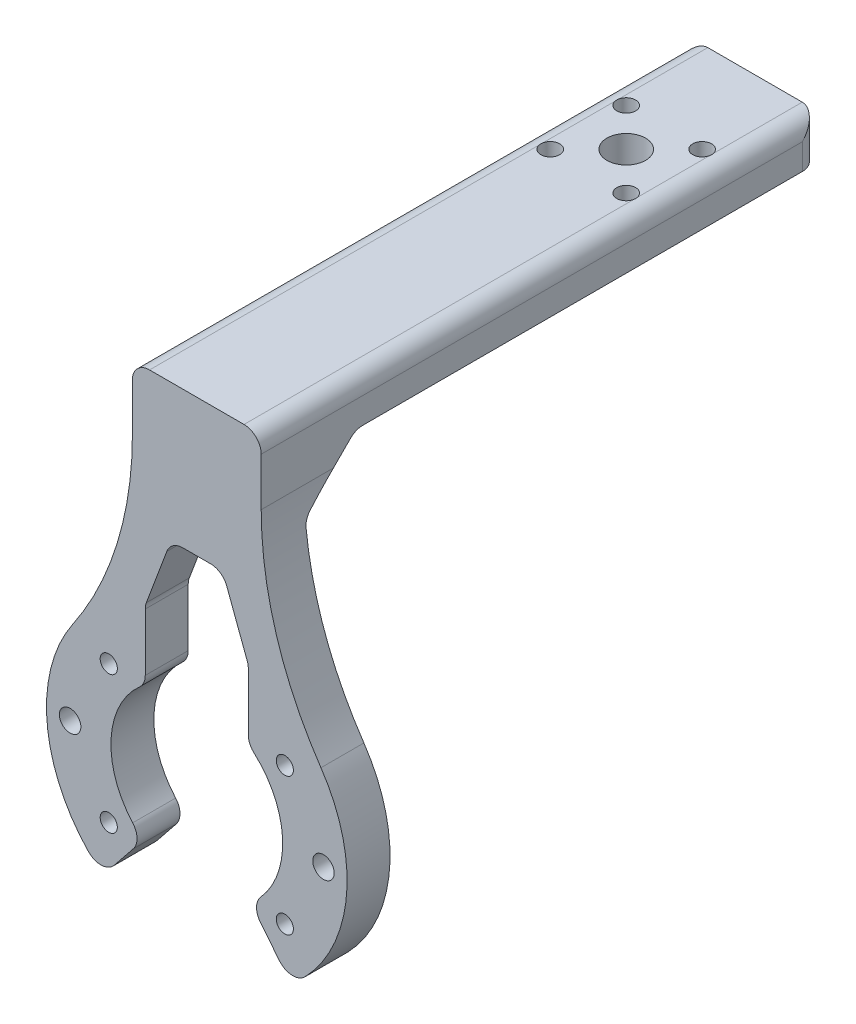
from build123d import *

# Parameters (mm, degrees)
SKETCH_1_R                   = 1
SKETCH_1_R_2                 = 1.25
EXTRUDE_1_DEPTH              = 5
EXTRUDE_2_DEPTH              = 7.5
SKETCH_5_R                   = 2.25
CUT_EXTRUDE_1_DEPTH          = 15
FILLET_2_R                   = 40
HOLE_WIZARD_M2_1_D           = 2.2
HOLE_WIZARD_M2_1_CBORE_D     = 4.3
HOLE_WIZARD_M2_1_CBORE_DEPTH = 2.3
CUT_EXTRUDE_2_DEPTH          = 79.302298817
FILLET_1_R                   = 2


with BuildPart() as part:
    # 草图1 → 凸台-拉伸1 (new body)
    # profile 1 of 2: a face of its own
    with BuildSketch(Plane.XY):
        with BuildLine():
            ThreePointArc((7.5, 15.811388301), (0, 17.5), (-7.5, 15.811388301))
            ThreePointArc((-7.5, 15.811388301), (-17.382056071, 2.028331029), (-10.939015625, -13.659719512))
            Line((-10.939015625, -13.659719512), (-6.250866071, -7.805554007))
            ThreePointArc((-6.250866071, -7.805554007), (-4.329626963, 9.01411839), (10, 0))
            ThreePointArc((10, 0), (9.01411839, -4.329626963), (6.250866071, -7.805554007))
            Line((6.250866071, -7.805554007), (10.939015625, -13.659719512))
            ThreePointArc((10.939015625, -13.659719512), (15.774707183, -7.576847186), (17.5, 0))
            ThreePointArc((17.5, 0), (14.790199458, 9.354143467), (7.5, 15.811388301))
        make_face()
        with Locations((-10.25, -8)):
            Circle(SKETCH_1_R, mode=Mode.SUBTRACT)
        with Locations((-14.75, 0)):
            Circle(SKETCH_1_R_2, mode=Mode.SUBTRACT)
        with Locations((-10.25, 8)):
            Circle(SKETCH_1_R, mode=Mode.SUBTRACT)
        with Locations((10.25, -8)):
            Circle(SKETCH_1_R, mode=Mode.SUBTRACT)
        with Locations((14.75, 0)):
            Circle(SKETCH_1_R_2, mode=Mode.SUBTRACT)
        with Locations((10.25, 8)):
            Circle(SKETCH_1_R, mode=Mode.SUBTRACT)
    # profile 2 of 2: a face of its own
    with BuildSketch(Plane.XY):
        with BuildLine():
            Line((-7.5, 40), (-7.5, 15.811388301))
            ThreePointArc((-7.5, 15.811388301), (0, 17.5), (7.5, 15.811388301))
            Line((7.5, 15.811388301), (7.5, 40))
            Line((7.5, 40), (-7.5, 40))
        make_face()
    extrude(amount=EXTRUDE_1_DEPTH)

    # 草图3 → 凸台-拉伸2 (add, symmetric)
    with BuildSketch(Plane(origin=(0, 0, 0), x_dir=(0, 0, -1), z_dir=(1, 0, 0))):
        Polygon((0, 40), (60, 40), (60, 35), (6, 35), (0, 29), align=None)
    extrude(amount=EXTRUDE_2_DEPTH, both=True)

    # 草图5 → 切除-拉伸1 (cut)
    with BuildSketch(Plane.XZ.offset(-35)):
        with Locations(Location((0, -45, 0), (0, 0, 270))):
            Circle(SKETCH_5_R)
    extrude(amount=-CUT_EXTRUDE_1_DEPTH, mode=Mode.SUBTRACT)

    # 圆角2
    # the kernel refuses this fillet: 40 mm, written as the material it adds along each edge
    with BuildSketch(Plane(origin=(-7.5, 15.811388301, -41.480787978), x_dir=(-0.759976311594863, -0.6499507718394276, 0), z_dir=(0, 0, 1))) as fillet_2_piece_1_section:
        with BuildLine():
            CenterArc((19.614864399, -38.607797373), FILLET_2_R, 105.160956859, 34.301152757)
            Line((-10.784188065, -12.6097665), (0, 0))
            ThreePointArc((0, 0), (4.576801693, -0.609088649), (9.153603386, 0))
        make_face()
    fillet_2_piece_1 = extrude(amount=46.480787978, mode=Mode.PRIVATE)
    fillet_2_piece_1 = split(fillet_2_piece_1, bisect_by=Plane(origin=(-7.11257259, 31.242526898, 0), z_dir=(0, 0, -1)), keep=Keep.TOP, mode=Mode.PRIVATE)
    fillet_2_piece_1 = split(fillet_2_piece_1, bisect_by=Plane(origin=(-7.11257259, 30.681895174, -1.681895174), z_dir=(0, 0.7071067811865467, 0.7071067811865486)), keep=Keep.TOP, mode=Mode.PRIVATE)
    add(fillet_2_piece_1)
    with BuildSketch(Plane(origin=(-7.5, 15.811388301, 0), x_dir=(-0.7599763115948637, -0.6499507718394266, 0), z_dir=(0, 0, 1))) as fillet_2_piece_2_section:
        with BuildLine():
            CenterArc((19.614864399, -38.607797373), FILLET_2_R, 105.160956859, 34.301152757)
            Line((-10.784188065, -12.6097665), (0, 0))
            ThreePointArc((0, 0), (4.576801693, -0.609088649), (9.153603386, 0))
        make_face()
    fillet_2_piece_2 = extrude(amount=5, mode=Mode.PRIVATE)
    fillet_2_piece_2 = split(fillet_2_piece_2, bisect_by=Plane(origin=(-9.04323472, 22.224032405, 6.775967595), z_dir=(0, -0.7071067811865467, -0.7071067811865486)), keep=Keep.TOP, mode=Mode.PRIVATE)
    add(fillet_2_piece_2)
    with BuildSketch(Plane(origin=(-7.5, 15.811388301, 0), x_dir=(-0.7599763115948637, -0.6499507718394266, 0), z_dir=(0, 0, 1))) as fillet_2_piece_3_section:
        with BuildLine():
            CenterArc((19.614864399, -38.607797373), FILLET_2_R, 105.160956859, 34.301152757)
            Line((-10.784188065, -12.6097665), (0, 0))
            ThreePointArc((0, 0), (4.576801693, -0.609088649), (9.153603386, 0))
        make_face()
    fillet_2_piece_3 = extrude(amount=5, mode=Mode.PRIVATE)
    fillet_2_piece_3 = split(fillet_2_piece_3, bisect_by=Plane(origin=(-7.203009065, 27.482958496, 1.517041504), z_dir=(0, 0.7071067811865467, 0.7071067811865486)), keep=Keep.TOP, mode=Mode.PRIVATE)
    add(fillet_2_piece_3)
    with BuildSketch(Plane(origin=(7.5, 15.811388301, -41.480787978), x_dir=(0.7599763115948623, -0.6499507718394282, 0), z_dir=(0, 0, 1))) as fillet_2_piece_4_section:
        with BuildLine():
            CenterArc((19.614864399, 38.607797373), FILLET_2_R, 220.537890384, 34.301152757)
            Line((-10.784188065, 12.6097665), (0, 0))
            ThreePointArc((0, 0), (4.576801693, 0.609088649), (9.153603386, 0))
        make_face()
    fillet_2_piece_4 = extrude(amount=46.480787978, mode=Mode.PRIVATE)
    fillet_2_piece_4 = split(fillet_2_piece_4, bisect_by=Plane(origin=(7.11257259, 31.242526898, 0), z_dir=(0, 0, -1)), keep=Keep.TOP, mode=Mode.PRIVATE)
    fillet_2_piece_4 = split(fillet_2_piece_4, bisect_by=Plane(origin=(7.11257259, 30.681895174, -1.681895174), z_dir=(0, 0.7071067811865467, 0.7071067811865486)), keep=Keep.TOP, mode=Mode.PRIVATE)
    add(fillet_2_piece_4)
    with BuildSketch(Plane(origin=(7.5, 15.811388301, 0), x_dir=(0.7599763115948623, -0.6499507718394282, 0), z_dir=(0, 0, 1))) as fillet_2_piece_5_section:
        with BuildLine():
            CenterArc((19.614864399, 38.607797373), FILLET_2_R, 220.537890384, 34.301152757)
            Line((-10.784188065, 12.6097665), (0, 0))
            ThreePointArc((0, 0), (4.576801693, 0.609088649), (9.153603386, 0))
        make_face()
    fillet_2_piece_5 = extrude(amount=5, mode=Mode.PRIVATE)
    fillet_2_piece_5 = split(fillet_2_piece_5, bisect_by=Plane(origin=(9.04323472, 22.224032405, 6.775967595), z_dir=(0, -0.7071067811865467, -0.7071067811865486)), keep=Keep.TOP, mode=Mode.PRIVATE)
    add(fillet_2_piece_5)
    with BuildSketch(Plane(origin=(7.5, 15.811388301, 0), x_dir=(0.7599763115948623, -0.6499507718394282, 0), z_dir=(0, 0, 1))) as fillet_2_piece_6_section:
        with BuildLine():
            CenterArc((19.614864399, 38.607797373), FILLET_2_R, 220.537890384, 34.301152757)
            Line((-10.784188065, 12.6097665), (0, 0))
            ThreePointArc((0, 0), (4.576801693, 0.609088649), (9.153603386, 0))
        make_face()
    fillet_2_piece_6 = extrude(amount=5, mode=Mode.PRIVATE)
    fillet_2_piece_6 = split(fillet_2_piece_6, bisect_by=Plane(origin=(7.203009065, 27.482958496, 1.517041504), z_dir=(0, 0.7071067811865467, 0.7071067811865486)), keep=Keep.TOP, mode=Mode.PRIVATE)
    add(fillet_2_piece_6)

    # M2 六角圆柱头螺钉的柱形沉头孔1 (through all)
    with Locations(Plane(origin=(0, 35, 0), x_dir=(-1, 0, 0), z_dir=(0, -1, 0))):
        with Locations((4.419417382, 40.580582618), (-4.419417382, 40.580582618), (-4.419417382, 49.419417382), (4.419417382, 49.419417382)):
            CounterBoreHole(HOLE_WIZARD_M2_1_D / 2, HOLE_WIZARD_M2_1_CBORE_D / 2, HOLE_WIZARD_M2_1_CBORE_DEPTH)

    # 草图9 → 切除-拉伸2 (cut, through all)
    with BuildSketch(Plane.XY.offset(5)):
        Polygon((-3, 24), (-6, 16), (-6, 8), (6, 8), (6, 16), (3, 24), align=None)
    extrude(amount=-CUT_EXTRUDE_2_DEPTH, mode=Mode.SUBTRACT)

    # 圆角1
    fillet_1_edges = [part.edges().sort_by_distance(p)[0] for p in [
        (10.939015625, -13.659719512, 2.5),
        (6.250866071, -7.805554007, 2.5),
        (-6.250866071, -7.805554007, 2.5),
        (-10.939015625, -13.659719512, 2.5),
        (-7.5, 40, -27.5),
        (7.5, 40, -27.5),
        (0, 29, 0),
        (0, 35, -6),
        (-7.5, 37.5, -60),
        (7.5, 37.5, -60),
        (-6, 8, 2.5),
        (6, 8, 2.5),
        (6, 16, 2.5),
        (3, 24, 2.5),
        (-6, 16, 2.5),
        (-3, 24, 2.5),
    ]]
    fillet(fillet_1_edges, radius=FILLET_1_R)


solid = part.part
